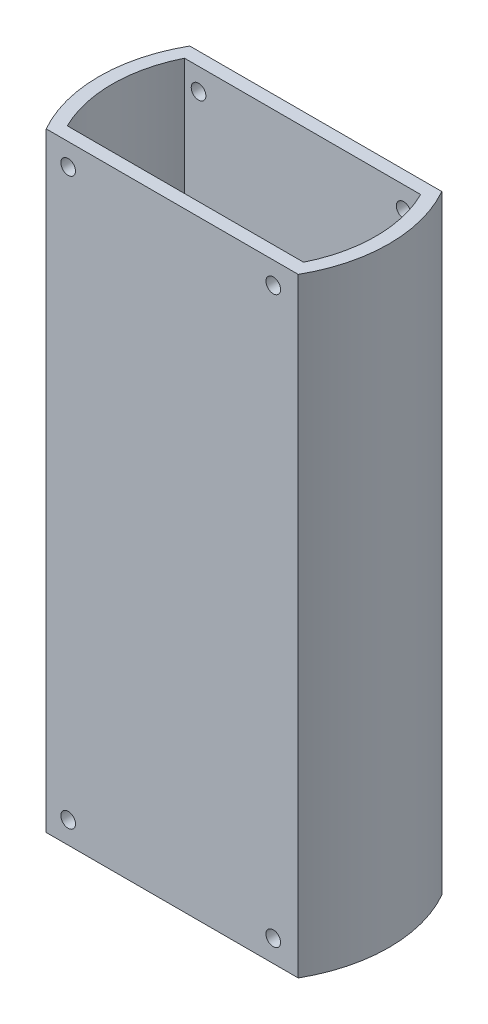
from build123d import *

# Parameters (mm, degrees)
BOSS_EXTRUDE1_DEPTH = 208
SKETCH3_R           = 2.5
CUT_EXTRUDE1_DEPTH  = 60


with BuildPart() as part:
    # Sketch2 → Boss-Extrude1 (new body)
    with BuildSketch(Plane(origin=(0, 0, 0), x_dir=(1, 0, 0), z_dir=(0, 1, 0))):
        with BuildLine():
            ThreePointArc((43.011626335, -24.5), (49.5, 0), (43.011626335, 24.5))
            Line((43.011626335, 24.5), (-43.011626335, 24.5))
            ThreePointArc((-43.011626335, 24.5), (-49.5, 0), (-43.011626335, -24.5))
            Line((-43.011626335, -24.5), (43.011626335, -24.5))
        make_face()
        with BuildLine():
            Line((40.311288741, -20), (-40.311288741, -20))
            ThreePointArc((-40.311288741, -20), (-45, 0), (-40.311288741, 20))
            Line((-40.311288741, 20), (40.311288741, 20))
            ThreePointArc((40.311288741, 20), (45, 0), (40.311288741, -20))
        make_face(mode=Mode.SUBTRACT)
    extrude(amount=BOSS_EXTRUDE1_DEPTH)

    # Sketch3 → Cut-Extrude1 (cut)
    with BuildSketch(Plane.XY.offset(24.5)):
        with Locations((-35.511626335, 200.5)):
            Circle(SKETCH3_R)
        with Locations((34.488373665, 200.5)):
            Circle(SKETCH3_R)
        with Locations((34.488373665, 7.5)):
            Circle(SKETCH3_R)
        with Locations((-35.511626335, 7.5)):
            Circle(SKETCH3_R)
    extrude(amount=-CUT_EXTRUDE1_DEPTH, mode=Mode.SUBTRACT)


solid = part.part
